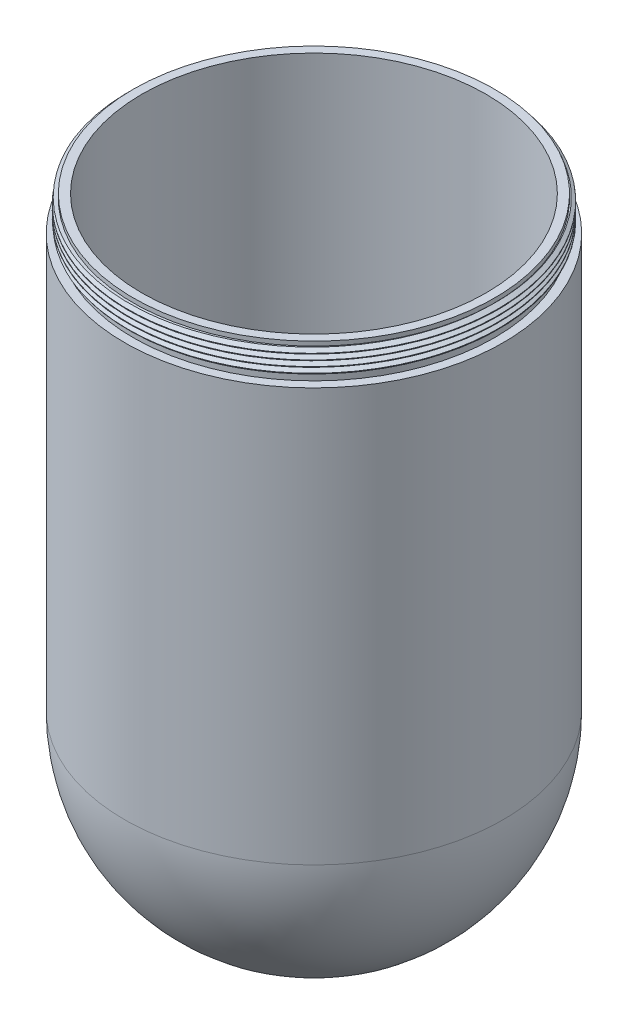
from build123d import *

# Parameters (mm, degrees)
CUT_EXTRUDE1_START  = -12.7
SKETCH3_R           = 69.85
CUT_EXTRUDE1_DEPTH  = 12.7
BOSS_EXTRUDE2_START = 12.7
SKETCH4_R           = 66.675
SKETCH4_R_2         = 63.5
BOSS_EXTRUDE2_DEPTH = 12.7
SKETCH5_R           = 68.2625
SKETCH5_R_2         = 66.675
BOSS_EXTRUDE3_DEPTH = 9.525
SKETCH7_R           = 68.2625
SKETCH7_R_2         = 66.675
CUT_EXTRUDE2_DEPTH  = 1.5875
CUT_SWEEP4_PITCH    = 2.116666667


with BuildPart() as part:
    # Sketch1 → Revolve1 (revolve)
    with BuildSketch(Plane.XY, mode=Mode.PRIVATE) as revolve1_sk:
        with BuildLine():
            Line((63.5, 0), (63.5, 152.4))
            Line((63.5, 152.4), (66.675, 152.4))
            Line((66.675, 152.4), (66.675, 165.1))
            Line((66.675, 165.1), (69.85, 165.1))
            Line((69.85, 165.1), (69.85, 152.4))
            Line((69.85, 152.4), (69.85, 0))
            ThreePointArc((69.85, 0), (49.391408666, -49.391408666), (0, -69.85))
            Line((0, -69.85), (0, -63.5))
            ThreePointArc((0, -63.5), (44.901280605, -44.901280605), (63.5, 0))
        make_face()
    revolve(revolve1_sk.sketch.rotate(Axis((0, -63.5, 0), (0, -1, 0)), 180), axis=Axis((0, -63.5, 0), (0, -1, 0)))

    # Sketch3 → Cut-Extrude1 (cut)
    with BuildSketch(Plane(origin=(0, 165.1, 0), x_dir=(1, 0, 0), z_dir=(0, 1, 0)).offset(CUT_EXTRUDE1_START)):
        with Locations(Location((0, 0, 0), (0, 0, 180))):
            Circle(SKETCH3_R)
    extrude(amount=CUT_EXTRUDE1_DEPTH, mode=Mode.SUBTRACT)

    # Sketch4 → Boss-Extrude2 (add)
    with BuildSketch(Plane(origin=(0, 152.4, 0), x_dir=(1, 0, 0), z_dir=(0, 1, 0)).offset(BOSS_EXTRUDE2_START)):
        Circle(SKETCH4_R)
        with Locations(Location((0, 0, 0), (0, 0, 180))):
            Circle(SKETCH4_R_2, mode=Mode.SUBTRACT)
    extrude(amount=-BOSS_EXTRUDE2_DEPTH)

    # Sketch5 → Boss-Extrude3 (add)
    with BuildSketch(Plane(origin=(0, 165.1, 0), x_dir=(1, 0, 0), z_dir=(0, 1, 0))):
        with Locations(Location((0, 0, 0), (0, 0, 180))):
            Circle(SKETCH5_R)
        Circle(SKETCH5_R_2, mode=Mode.SUBTRACT)
    extrude(amount=-BOSS_EXTRUDE3_DEPTH)

    # Sketch7 → Cut-Extrude2 (cut)
    with BuildSketch(Plane(origin=(0, 165.1, 0), x_dir=(1, 0, 0), z_dir=(0, 1, 0))):
        with Locations(Location((0, 0, 0), (0, 0, 180))):
            Circle(SKETCH7_R)
        Circle(SKETCH7_R_2, mode=Mode.SUBTRACT)
    extrude(amount=-CUT_EXTRUDE2_DEPTH, mode=Mode.SUBTRACT)

    # Cut-Sweep4: arcs per turn and ends read off the stored shape
    # Cut-Sweep4: the profile of Sketch9 profile screwed along a right-hand helix through 5 turns, 10 arcs to a turn; built about Z, then put on its axis
    cut_sweep4_z = Axis((0, 0, 0), (0, 0, 1))
    cut_sweep4_corners = [(68.2628, 0, -0.132331513), (66.675, 0, -1.063840931), (68.2628, 0, -1.995350349)]
    with BuildLine(mode=Mode.PRIVATE) as cut_sweep4_profile:
        Line(cut_sweep4_corners[0], cut_sweep4_corners[1])
        Line(cut_sweep4_corners[1], cut_sweep4_corners[2])
        Line(cut_sweep4_corners[2], cut_sweep4_corners[0])
    cut_sweep4_cap = Face(cut_sweep4_profile.wire())
    cut_sweep4_turn_angles = [0, 18, 36, 54, 72, 90, 108, 126, 144, 162, 180, 198, 216, 234, 252, 270, 288, 306, 324, 342, 360]
    cut_sweep4_turn_weights = [1, 0.9510565162951535, 1, 0.9510565162951535, 1, 0.9510565162951535, 1, 0.9510565162951535, 1, 0.9510565162951535, 1, 0.9510565162951535, 1, 0.9510565162951535, 1, 0.9510565162951535, 1, 0.9510565162951535, 1, 0.9510565162951535, 1]
    cut_sweep4_turn_rails = [Edge.make_bspline([Vector(p[0], p[1], 0).rotate(cut_sweep4_z, cut_sweep4_turn_angles[k]) / cut_sweep4_turn_weights[k] + Vector(0, 0, p[2] + CUT_SWEEP4_PITCH * cut_sweep4_turn_angles[k] / 360) for k in range(21)], [0, 0, 0, 1, 1, 2, 2, 3, 3, 4, 4, 5, 5, 6, 6, 7, 7, 8, 8, 9, 9, 10, 10, 10], 2, cut_sweep4_turn_weights) for p in cut_sweep4_corners]
    cut_sweep4_turn_sides = [Face.make_surface_from_curves(cut_sweep4_turn_rails[p[0]], cut_sweep4_turn_rails[p[1]]) for p in [(0, 1), (1, 2), (2, 0)]]
    cut_sweep4 = Plane(origin=(0, 163.5125, 0), x_dir=(-1, 0, 0), z_dir=(0, -1, 0)) * Solid(Shell([*[p.moved(Location((0, 0, CUT_SWEEP4_PITCH * i))) for i in range(5) for p in cut_sweep4_turn_sides], cut_sweep4_cap, cut_sweep4_cap.rotate(cut_sweep4_z, 1800).moved(Location((0, 0, CUT_SWEEP4_PITCH * 1800 / 360)))]))
    add(cut_sweep4, mode=Mode.SUBTRACT)


solid = part.part
